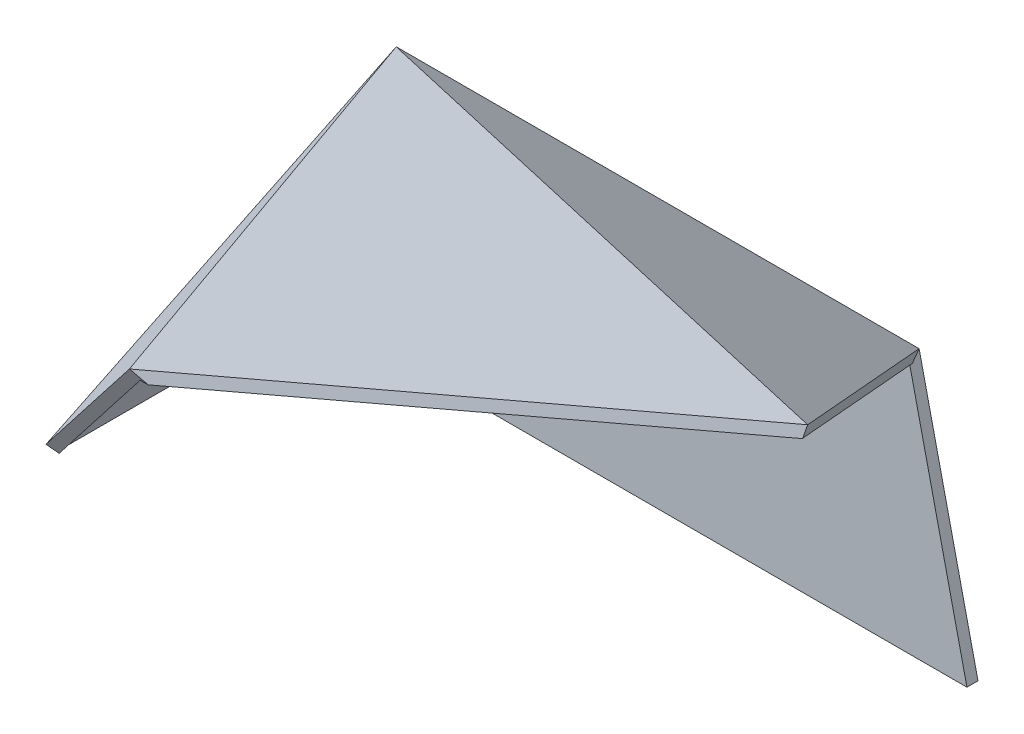
from build123d import *

# Parameters (mm, degrees)
EXTRUDE1_DEPTH  = 3
EXTRUDE2_DEPTH  = 3
EXTRUDE4_DEPTH  = 3
EXTRUDE5_DEPTH  = 3
EXTRUDE6_DEPTH  = 3
SKETCH10_W      = 112.57156026
SKETCH10_H      = 90.15603265
EXTRUDE7_DEPTH  = 3
SKETCH11_W      = 73.757764298
SKETCH11_H      = 14.759555355
EXTRUDE8_DEPTH  = 3
SKETCH12_W      = 167.871510219
SKETCH12_H      = 195.865171009
EXTRUDE10_DEPTH = 3
SKETCH13_W      = 44.568245146
SKETCH13_H      = 24.512134406
EXTRUDE11_DEPTH = 3
SKETCH14_W      = 60.210030943
SKETCH14_H      = 16.018184112
EXTRUDE12_DEPTH = 3
SKETCH15_W      = 14.88927725
SKETCH15_H      = 13.487454676
EXTRUDE13_DEPTH = 3


with BuildPart() as part:
    # Sketch1 → Extrude1 (new body)
    with BuildSketch(Plane.XY):
        Polygon((-295, -10), (-113.158578494, -10), (-129.119149358, 60), (-270.857265661, 60), align=None)
    extrude(amount=-EXTRUDE1_DEPTH)

    # Sketch2 → Extrude2 (add)
    with BuildSketch(Plane(origin=(-260.556909704, 89.865089302, 0), x_dir=(0, 0, 1), z_dir=(-0.9453529883919826, 0.32604865793060395, 0))):
        Polygon((0, -31.591468656), (0, -105.637883973), (67.792764425, -105.637883973), align=None)
    extrude(amount=-EXTRUDE2_DEPTH)

    # Sketch7 → Extrude4 (add)
    with BuildSketch(Plane(origin=(0, 43.724883183, -28.218487637), x_dir=(1, 0, 0), z_dir=(0, 0.8402188568223107, -0.542247427509075))):
        Polygon((-66.361624075, -140.664783174), (-129.119149358, -30.01418908), (-270.857265661, -30.01418908), align=None)
    extrude(amount=-EXTRUDE4_DEPTH)

    # Sketch8 → Extrude5 (add)
    with BuildSketch(Plane(origin=(-194.933156921, 134.953208188, 66.963130911), x_dir=(0.2250247406448192, -0.1524757978663248, 0.9623486879311259), z_dir=(-0.7912394867825434, 0.5477790893702926, 0.2718053417516856))):
        Polygon((74.528855999, -40.832608478), (-72.985179893, -104.644430853), (0.382737384, -176.140135834), align=None)
    extrude(amount=-EXTRUDE5_DEPTH)

    # Sketch9 → Extrude6 (add)
    with BuildSketch(Plane(origin=(-30.531564034, 120.326118689, -10.497879236), x_dir=(0.9695050365136778, 0.24414396845566366, -0.021300395332766054), z_dir=(-0.24507138587483487, 0.9658361632356843, -0.08426459287007951))):
        Polygon((-36.95706437, -100.060049534), (-176.221988163, -146.089942976), (-247.884943942, -2.226256699), align=None)
    extrude(amount=-EXTRUDE6_DEPTH)

    # Sketch10 → Extrude7 (cut)
    with BuildSketch(Plane(origin=(-194.933156921, 134.953208188, 66.963130911), x_dir=(0.22347650639425914, -0.1547139130607434, 0.9623522516185274), z_dir=(-0.7912394867825433, 0.5477790893702926, 0.2718053417516856))):
        with Locations((-39.401841305, -133.616606124)):
            Rectangle(SKETCH10_W, SKETCH10_H)
    extrude(amount=EXTRUDE7_DEPTH, mode=Mode.SUBTRACT)

    # Sketch11 → Extrude8 (cut)
    with BuildSketch(Plane(origin=(0, 0, -3), x_dir=(-1, 0, 0), z_dir=(0, 0, -1))):
        with Locations((276.218608966, 62.807931157)):
            Rectangle(SKETCH11_W, SKETCH11_H)
    extrude(amount=EXTRUDE8_DEPTH, mode=Mode.SUBTRACT)

    # Sketch12 → Extrude10 (cut)
    with BuildSketch(Plane.XZ.offset(10)):
        with Locations((-271.948656963, 73.44943118)):
            Rectangle(SKETCH12_W, SKETCH12_H)
    extrude(amount=EXTRUDE10_DEPTH, mode=Mode.SUBTRACT)

    # Sketch13 → Extrude11 (cut)
    with BuildSketch(Plane(origin=(-6.450704838, -44.957686549, 71.826506745), x_dir=(0.9971148878937374, -0.040273310097748635, 0.06434252741717664), z_dir=(-0.0759071824049579, -0.5290292145082109, 0.845201863377126))):
        with Locations((-195.528663134, 143.517199712)):
            Rectangle(SKETCH13_W, SKETCH13_H)
    extrude(amount=EXTRUDE11_DEPTH, mode=Mode.SUBTRACT)

    # Sketch14 → Extrude12 (cut)
    with BuildSketch(Plane(origin=(25.376884403, 13.273606688, 78.336355767), x_dir=(0.9525912760030386, -0.05082924450610781, -0.2999770804342244), z_dir=(0.3042529554218049, 0.15914223352478768, 0.9392038589283155))):
        with Locations((-92.868466648, 100.970417501)):
            Rectangle(SKETCH14_W, SKETCH14_H)
    extrude(amount=EXTRUDE12_DEPTH, mode=Mode.SUBTRACT)

    # Sketch15 → Extrude13 (cut)
    with BuildSketch(Plane(origin=(-110.5730929, 34.006271488, 52.693123295), x_dir=(-0.39620203994830133, 0.12185020587824674, -0.910042015990599), z_dir=(0.8698349100305545, -0.2675139251709543, -0.4145160179435368))):
        with Locations((-37.910748446, 93.865777742)):
            Rectangle(SKETCH15_W, SKETCH15_H)
    extrude(amount=EXTRUDE13_DEPTH, mode=Mode.SUBTRACT)


solid = part.part
